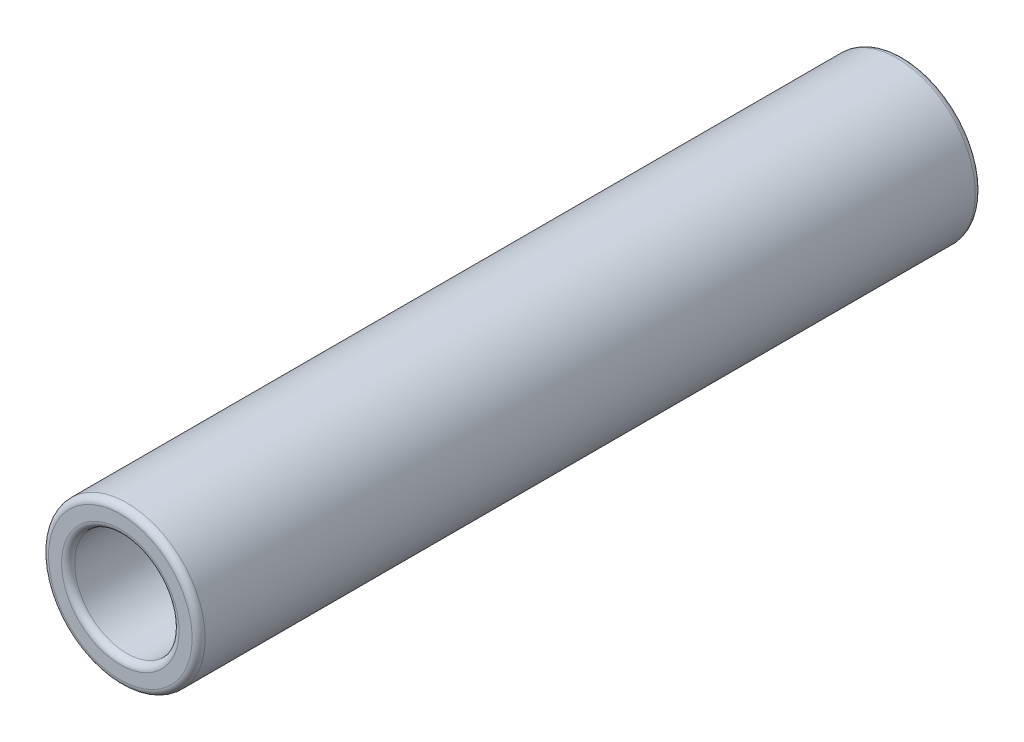
from build123d import *

# Parameters (mm, degrees)
SKETCH1_R           = 6
SKETCH1_R_2         = 4
BOSS_EXTRUDE1_DEPTH = 30
FILLET1_R           = 0.5


with BuildPart() as part:
    # Sketch1 → Boss-Extrude1 (new, symmetric)
    with BuildSketch(Plane.XY):
        Circle(SKETCH1_R)
        Circle(SKETCH1_R_2, mode=Mode.SUBTRACT)
    extrude(amount=BOSS_EXTRUDE1_DEPTH, both=True)

    # Fillet1
    fillet1_edges = [part.edges().sort_by_distance(p)[0] for p in [
        (-4, 0, -30),
        (-4, 0, 30),
        (-6, 0, -30),
        (-6, 0, 30),
    ]]
    fillet(fillet1_edges, radius=FILLET1_R)


solid = part.part
